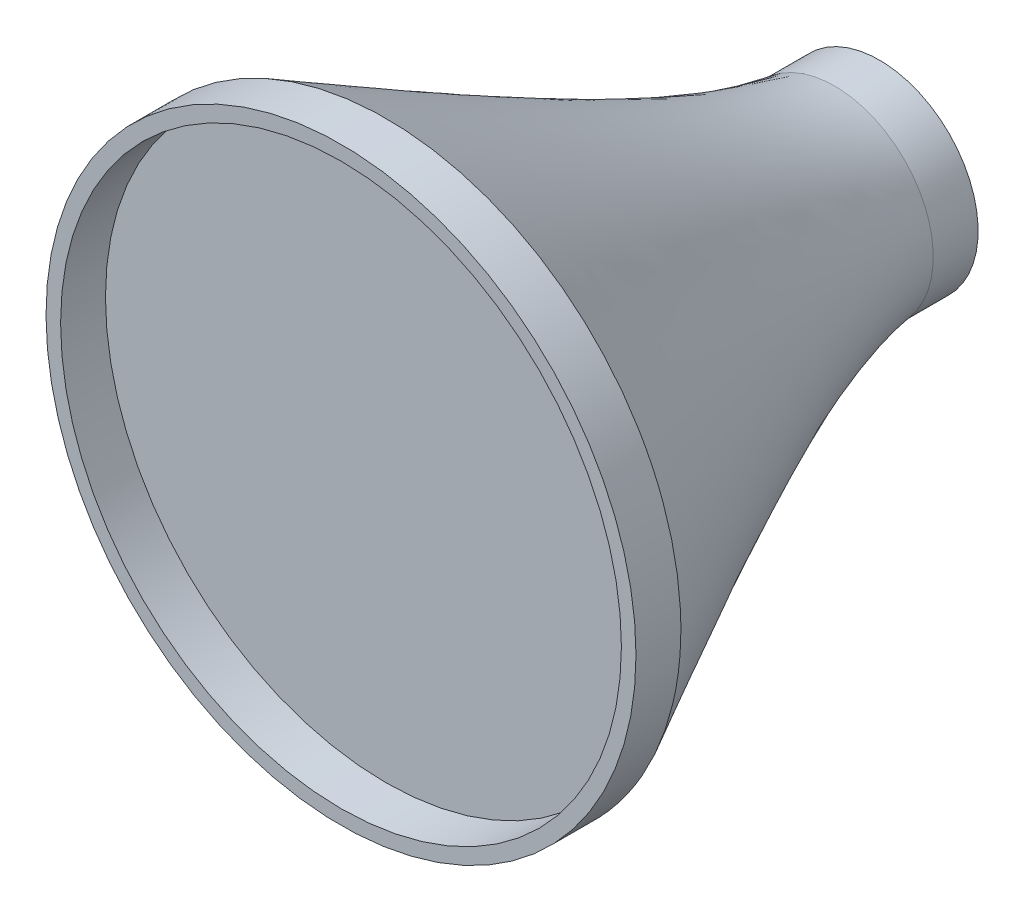
from build123d import *

# Parameters (mm, degrees)
SKETCH6_R           = 16.7005
SKETCH6_R_2         = 15.875
BOSS_EXTRUDE1_DEPTH = 2.54
SKETCH7_R           = 5.588
SKETCH7_R_2         = 5.08
BOSS_EXTRUDE2_DEPTH = 2.54


with BuildPart() as part:
    # Loft1: read off the stored shape, not the designer's step
    # Loft1: loft between two sections, ruled curve by curve
    loft1_from = [
        Edge.make_bspline([(-15.531591954, 6.138106517, 0), (-3.25537892, 37.201290426, 0), (27.807804989, 24.925077391, 0), (15.531591954, -6.138106517, 0), (3.25537892, -37.201290426, 0), (-27.807804989, -24.925077391, 0), (-15.531591954, 6.138106517, 0)], [0, 0, 0, 0, 0.5, 0.5, 0.5, 1, 1, 1, 1], 3, [1, 0.333333333, 0.333333333, 1, 0.333333333, 0.333333333, 1]),
    ]
    loft1_to = [
        Edge.make_bspline([(-1.095329605, 5.479598257, -25.4), (9.863866909, 7.670257467, -25.4), (12.054526119, -3.288939047, -25.4), (1.095329605, -5.479598257, -25.4), (-9.863866909, -7.670257467, -25.4), (-12.054526119, 3.288939047, -25.4), (-1.095329605, 5.479598257, -25.4)], [0, 0, 0, 0, 0.5, 0.5, 0.5, 1, 1, 1, 1], 3, [1, 0.333333333, 0.333333333, 1, 0.333333333, 0.333333333, 1]),
    ]
    loft1 = Solid(Shell([*[Face.make_surface_from_curves(loft1_from[k], loft1_to[k]) for k in range(1)], Face(Wire(loft1_from)), Face(Wire(loft1_to))]))
    add(loft1)

    # Sketch6 → Boss-Extrude1 (add)
    with BuildSketch(Plane.XY):
        with Locations(Location((0, 0, 0), (0, 0, 158.436))):
            Circle(SKETCH6_R)
        Circle(SKETCH6_R_2, mode=Mode.SUBTRACT)
    extrude(amount=BOSS_EXTRUDE1_DEPTH)

    # Sketch7 → Boss-Extrude2 (add)
    with BuildSketch(Plane(origin=(0, 0, -25.4), x_dir=(-1, 0, 0), z_dir=(0, 0, -1))):
        with Locations(Location((0, 0, 0), (0, 0, 78.696))):
            Circle(SKETCH7_R)
        Circle(SKETCH7_R_2, mode=Mode.SUBTRACT)
    extrude(amount=BOSS_EXTRUDE2_DEPTH)


solid = part.part
